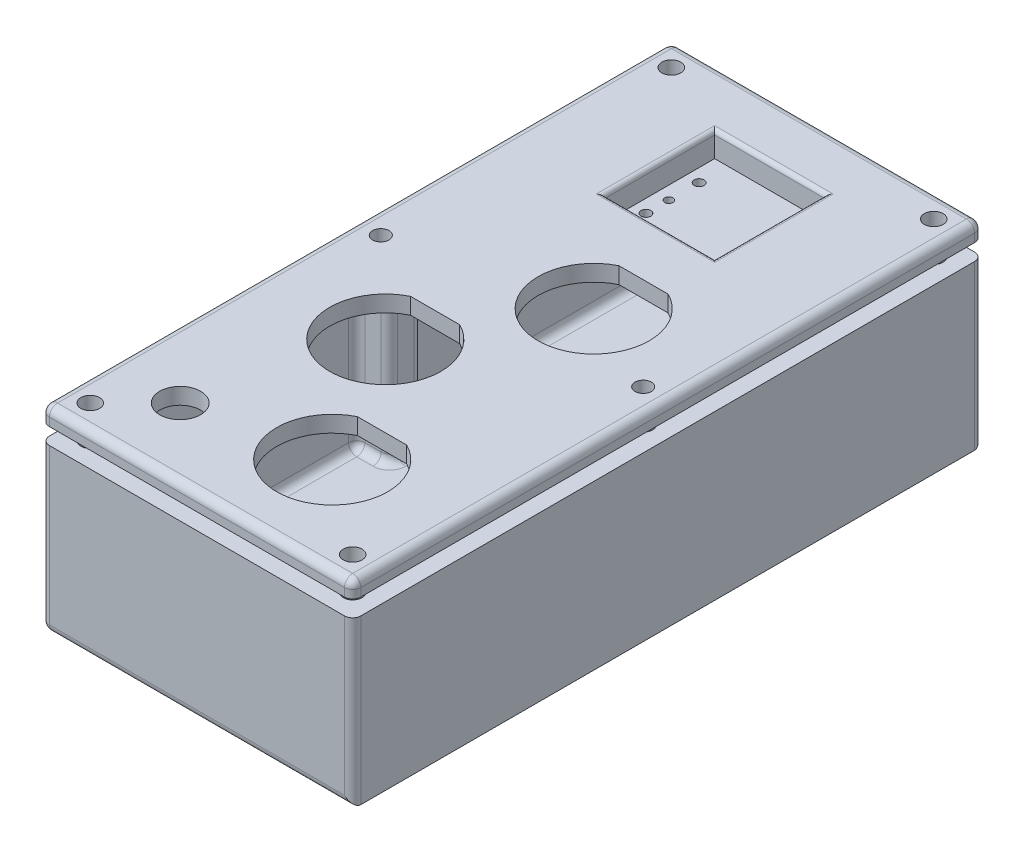
from build123d import *

# Parameters (mm, degrees)
CASE_OUTLINE_SKETCH_W          = 38.1
CASE_OUTLINE_SKETCH_H          = 77.08
BOSS_EXTRUDE1_DEPTH            = 20
CUT_EXTRUDE1_DEPTH             = 18
CASE_FILLET_R                  = 1
LID_SCREW_HOLES_SKETCH_R       = 1.15
CUT_EXTRUDE2_DEPTH             = 16
BOSS_EXTRUDE4_START            = 2
LID_SKETCH_AND_SCREW_HOLES_R   = 1.15
LID_SKETCH_AND_SCREW_HOLES_R_2 = 1
BOSS_EXTRUDE4_DEPTH            = 2
CUT_EXTRUDE3_REACH             = 50.293
LID_CUTTOUTS_SKETCH_R          = 2.5
SPLIT1_START                   = 20
SPLIT1_OUTLINE_R               = 1.15
SPLIT1_OUTLINE_R_2             = 2.5
SPLIT1_OUTLINE_R_3             = 1
SPLIT1_DEPTH                   = 2
SPLIT1_2_OUTLINE_R             = 1.15
SPLIT1_2_OUTLINE_R_2           = 2.5
SPLIT1_2_OUTLINE_R_3           = 1
SPLIT1_2_DEPTH                 = 2
LID_FILLET_R                   = 1
POWER_WIRES_ENTRY_R            = 1.5
CUT_EXTRUDE4_DEPTH             = 2
JOYSTICK_EXTRUSION_W           = 17.5
JOYSTICK_EXTRUSION_H           = 17.5
BOSS_EXTRUDE5_DEPTH            = 4.5
JOYSTICK_INDENTATION_W         = 13.5
JOYSTICK_INDENTATION_H         = 13.5
CUT_EXTRUDE5_DEPTH             = 3
JOYSTICK_HOLES_R               = 0.6
JOYSTICK_HOLES_R_2             = 0.5
CUT_EXTRUDE6_DEPTH             = 1.5
JOYSTICK_SOCKET_FILLET_R       = 0.5


with BuildPart() as part:
    # Case Outline Sketch → Boss-Extrude1 (new body)
    with BuildSketch(Plane(origin=(0, 0, 0), x_dir=(1, 0, 0), z_dir=(0, 1, 0))):
        Rectangle(CASE_OUTLINE_SKETCH_W, CASE_OUTLINE_SKETCH_H)
    extrude(amount=BOSS_EXTRUDE1_DEPTH)

    # Case Interior → Cut-Extrude1 (cut)
    with BuildSketch(Plane(origin=(0, 20, 0), x_dir=(1, 0, 0), z_dir=(0, 1, 0))):
        Polygon((-13.05, 36.54), (13.05, 36.54), (13.05, 32.54), (17.05, 32.54), (17.05, 2.055873023), (13.05, 2.055873023), (13.05, -1.944126977), (17.05, -1.944126977), (17.05, -32.54), (13.05, -32.54), (13.05, -36.54), (-13.05, -36.54), (-13.05, -32.54), (-17.05, -32.54), (-17.05, -1.944126977), (-13.05, -1.944126977), (-13.05, 2.055873023), (-17.05, 2.055873023), (-17.05, 32.54), (-13.05, 32.54), align=None)
    extrude(amount=-CUT_EXTRUDE1_DEPTH, mode=Mode.SUBTRACT)

    # Case Fillet
    case_fillet_edges = [part.edges().sort_by_distance(p)[0] for p in [
        (13.05, 11, -36.54),
        (13.05, 11, -32.54),
        (17.05, 11, -32.54),
        (17.05, 11, -2.055873023),
        (13.05, 11, -2.055873023),
        (13.05, 11, 1.944126977),
        (17.05, 11, 1.944126977),
        (17.05, 11, 32.54),
        (13.05, 11, 32.54),
        (13.05, 11, 36.54),
        (-13.05, 11, 36.54),
        (-13.05, 11, 32.54),
        (-17.05, 11, 32.54),
        (-17.05, 11, 1.944126977),
        (-13.05, 11, 1.944126977),
        (-13.05, 11, -2.055873023),
        (-17.05, 11, -2.055873023),
        (-17.05, 11, -32.54),
        (-13.05, 11, -32.54),
        (-13.05, 11, -36.54),
        (13.05, 2, -34.54),
        (15.05, 2, -32.54),
        (17.05, 2, -17.297936512),
        (15.05, 2, -2.055873023),
        (13.05, 2, -0.055873023),
        (15.05, 2, 1.944126977),
        (17.05, 2, 17.242063488),
        (15.05, 2, 32.54),
        (13.05, 2, 34.54),
        (-13.05, 2, 34.54),
        (-15.05, 2, 32.54),
        (-17.05, 2, 17.242063488),
        (-15.05, 2, 1.944126977),
        (-13.05, 2, -0.055873023),
        (-15.05, 2, -2.055873023),
        (-17.05, 2, -17.297936512),
        (-15.05, 2, -32.54),
        (-13.05, 2, -34.54),
        (0, 2, -36.54),
        (0, 0, 38.54),
        (-19.05, 0, 0),
        (0, 0, -38.54),
        (19.05, 10, 38.54),
        (-19.05, 10, 38.54),
        (-19.05, 10, -38.54),
        (19.05, 10, -38.54),
    ]]
    fillet(case_fillet_edges, radius=CASE_FILLET_R)

    # Lid Screw Holes Sketch → Cut-Extrude2 (cut)
    with BuildSketch(Plane(origin=(0, 20, 0), x_dir=(1, 0, 0), z_dir=(0, 1, 0))):
        with Locations(Location((-16.05, 35.54, 0), (0, 0, 270))):
            Circle(LID_SCREW_HOLES_SKETCH_R)
        with Locations(Location((16.05, 35.54, 0), (0, 0, 270))):
            Circle(LID_SCREW_HOLES_SKETCH_R)
        with Locations(Location((16.05, -35.54, 0), (0, 0, 270))):
            Circle(LID_SCREW_HOLES_SKETCH_R)
        with Locations(Location((-16.05, -35.54, 0), (0, 0, 270))):
            Circle(LID_SCREW_HOLES_SKETCH_R)
        with Locations(Location((-16.05, 0, 0), (0, 0, 270))):
            Circle(LID_SCREW_HOLES_SKETCH_R)
        with Locations(Location((16.05, 0, 0), (0, 0, 270))):
            Circle(LID_SCREW_HOLES_SKETCH_R)
    extrude(amount=-CUT_EXTRUDE2_DEPTH, mode=Mode.SUBTRACT)

    # Lid Sketch (and screw holes) → Boss-Extrude4 (add)
    with BuildSketch(Plane(origin=(0, 20, 0), x_dir=(1, 0, 0), z_dir=(0, 1, 0)).offset(BOSS_EXTRUDE4_START)):
        with BuildLine():
            Line((-19.05, 37.54), (-19.05, -37.54))
            ThreePointArc((-19.05, -37.54), (-18.757106781, -38.247106781), (-18.05, -38.54))
            Line((-18.05, -38.54), (18.05, -38.54))
            ThreePointArc((18.05, -38.54), (18.757106781, -38.247106781), (19.05, -37.54))
            Line((19.05, -37.54), (19.05, 37.54))
            ThreePointArc((19.05, 37.54), (18.757106781, 38.247106781), (18.05, 38.54))
            Line((18.05, 38.54), (-18.05, 38.54))
            ThreePointArc((-18.05, 38.54), (-18.757106781, 38.247106781), (-19.05, 37.54))
        make_face()
        with Locations(Location((-16.05, 35.54, 0), (0, 0, 270))):
            Circle(LID_SKETCH_AND_SCREW_HOLES_R, mode=Mode.SUBTRACT)
        with Locations(Location((-16.05, -35.54, 0), (0, 0, 270))):
            Circle(LID_SKETCH_AND_SCREW_HOLES_R, mode=Mode.SUBTRACT)
        with Locations(Location((16.05, -35.54, 0), (0, 0, 270))):
            Circle(LID_SKETCH_AND_SCREW_HOLES_R, mode=Mode.SUBTRACT)
        with Locations(Location((16.05, 35.54, 0), (0, 0, 270))):
            Circle(LID_SKETCH_AND_SCREW_HOLES_R, mode=Mode.SUBTRACT)
        with Locations(Location((-16.05, 0, 0), (0, 0, 270))):
            Circle(LID_SKETCH_AND_SCREW_HOLES_R_2, mode=Mode.SUBTRACT)
        with Locations(Location((16.05, 0, 0), (0, 0, 270))):
            Circle(LID_SKETCH_AND_SCREW_HOLES_R_2, mode=Mode.SUBTRACT)
    extrude(amount=-BOSS_EXTRUDE4_DEPTH)

    # Lid Cuttouts Sketch → Cut-Extrude3 (cut, up to next)
    with BuildSketch(Plane(origin=(0, 22, 0), x_dir=(1, 0, 0), z_dir=(0, 1, 0)), mode=Mode.PRIVATE) as cut_extrude3_sk1:
        with Locations(Location((-10.55, -30.04, 0), (0, 0, 270))):
            Circle(LID_CUTTOUTS_SKETCH_R)
    cut_extrude3_tool1 = extrude(cut_extrude3_sk1.sketch, amount=-CUT_EXTRUDE3_REACH, mode=Mode.PRIVATE) & part.part
    # Lid Cuttouts Sketch → Cut-Extrude3 (cut, up to next)
    with BuildSketch(Plane(origin=(0, 22, 0), x_dir=(1, 0, 0), z_dir=(0, 1, 0)), mode=Mode.PRIVATE) as cut_extrude3_sk2:
        with BuildLine():
            Line((7.75499584, 11.341869864), (1.74500416, 11.341869864))
            ThreePointArc((1.74500416, 11.341869864), (4.75, -1.558130136), (7.75499584, 11.341869864))
        make_face()
    cut_extrude3_tool2 = extrude(cut_extrude3_sk2.sketch, amount=-CUT_EXTRUDE3_REACH, mode=Mode.PRIVATE) & part.part
    # Lid Cuttouts Sketch → Cut-Extrude3 (cut, up to next)
    with BuildSketch(Plane(origin=(0, 22, 0), x_dir=(1, 0, 0), z_dir=(0, 1, 0)), mode=Mode.PRIVATE) as cut_extrude3_sk3:
        with BuildLine():
            Line((-1.74500416, -4.649065068), (-7.75499584, -4.649065068))
            ThreePointArc((-7.75499584, -4.649065068), (-4.75, -17.549065068), (-1.74500416, -4.649065068))
        make_face()
    cut_extrude3_tool3 = extrude(cut_extrude3_sk3.sketch, amount=-CUT_EXTRUDE3_REACH, mode=Mode.PRIVATE) & part.part
    # Lid Cuttouts Sketch → Cut-Extrude3 (cut, up to next)
    with BuildSketch(Plane(origin=(0, 22, 0), x_dir=(1, 0, 0), z_dir=(0, 1, 0)), mode=Mode.PRIVATE) as cut_extrude3_sk4:
        with BuildLine():
            Line((7.75499584, -20.64), (1.74500416, -20.64))
            ThreePointArc((1.74500416, -20.64), (4.75, -33.54), (7.75499584, -20.64))
        make_face()
    cut_extrude3_tool4 = extrude(cut_extrude3_sk4.sketch, amount=-CUT_EXTRUDE3_REACH, mode=Mode.PRIVATE) & part.part
    add(cut_extrude3_tool1.solids().sort_by_distance((-10.55, 22, 30.04))[0], mode=Mode.SUBTRACT)
    add(cut_extrude3_tool2.solids().sort_by_distance((4.75, 22, -5.114862))[0], mode=Mode.SUBTRACT)
    add(cut_extrude3_tool3.solids().sort_by_distance((-4.75, 22, 10.876073))[0], mode=Mode.SUBTRACT)
    add(cut_extrude3_tool4.solids().sort_by_distance((4.75, 22, 26.867008))[0], mode=Mode.SUBTRACT)

    # Split1 2 outline → Split1 2 (cut)
    with BuildSketch(Plane(origin=(0, 0, 0), x_dir=(1, 0, 0), z_dir=(0, 1, 0)).offset(SPLIT1_START)):
        with BuildLine():
            ThreePointArc((-18.05, 38.54), (-18.757106781, 38.247106781), (-19.05, 37.54))
            Line((-19.05, 37.54), (-19.05, -37.54))
            ThreePointArc((-19.05, -37.54), (-18.757106781, -38.247106781), (-18.05, -38.54))
            Line((-18.05, -38.54), (18.05, -38.54))
            ThreePointArc((18.05, -38.54), (18.757106781, -38.247106781), (19.05, -37.54))
            Line((19.05, -37.54), (19.05, 37.54))
            ThreePointArc((19.05, 37.54), (18.757106781, 38.247106781), (18.05, 38.54))
            Line((18.05, 38.54), (-18.05, 38.54))
        make_face()
        with Locations((-16.05, -35.54)):
            Circle(SPLIT1_2_OUTLINE_R, mode=Mode.SUBTRACT)
        with Locations((-10.55, -30.04)):
            Circle(SPLIT1_2_OUTLINE_R_2, mode=Mode.SUBTRACT)
        with BuildLine():
            ThreePointArc((-1.74500416, -4.649065068), (-4.75, -17.549065068), (-7.75499584, -4.649065068))
            Line((-7.75499584, -4.649065068), (-1.74500416, -4.649065068))
        make_face(mode=Mode.SUBTRACT)
        with BuildLine():
            ThreePointArc((7.75499584, -20.64), (4.75, -33.54), (1.74500416, -20.64))
            Line((1.74500416, -20.64), (7.75499584, -20.64))
        make_face(mode=Mode.SUBTRACT)
        with Locations((16.05, -35.54)):
            Circle(SPLIT1_2_OUTLINE_R, mode=Mode.SUBTRACT)
        with Locations((-16.05, 0)):
            Circle(SPLIT1_2_OUTLINE_R_3, mode=Mode.SUBTRACT)
        with Locations((-16.05, 35.54)):
            Circle(SPLIT1_2_OUTLINE_R, mode=Mode.SUBTRACT)
        with BuildLine():
            ThreePointArc((7.75499584, 11.341869864), (4.75, -1.558130136), (1.74500416, 11.341869864))
            Line((1.74500416, 11.341869864), (7.75499584, 11.341869864))
        make_face(mode=Mode.SUBTRACT)
        with Locations((16.05, 0)):
            Circle(SPLIT1_2_OUTLINE_R_3, mode=Mode.SUBTRACT)
        with Locations((16.05, 35.54)):
            Circle(SPLIT1_2_OUTLINE_R, mode=Mode.SUBTRACT)
    extrude(amount=SPLIT1_2_DEPTH, mode=Mode.SUBTRACT)

    # Power Wires Entry → Cut-Extrude4 (cut)
    with BuildSketch(Plane.XZ):
        with Locations(Location((0, 26.54, 0), (0, 0, 270))):
            Circle(POWER_WIRES_ENTRY_R)
    extrude(amount=-CUT_EXTRUDE4_DEPTH, mode=Mode.SUBTRACT)


with BuildPart() as body_2:
    # Split1: read off the stored shape, not the designer's step
    # Split1 outline → Split1 (new body)
    with BuildSketch(Plane(origin=(0, 0, 0), x_dir=(1, 0, 0), z_dir=(0, 1, 0)).offset(SPLIT1_START)):
        with BuildLine():
            Line((18.05, 38.54), (-18.05, 38.54))
            ThreePointArc((-18.05, 38.54), (-18.757106781, 38.247106781), (-19.05, 37.54))
            Line((-19.05, 37.54), (-19.05, -37.54))
            ThreePointArc((-19.05, -37.54), (-18.757106781, -38.247106781), (-18.05, -38.54))
            Line((-18.05, -38.54), (18.05, -38.54))
            ThreePointArc((18.05, -38.54), (18.757106781, -38.247106781), (19.05, -37.54))
            Line((19.05, -37.54), (19.05, 37.54))
            ThreePointArc((19.05, 37.54), (18.757106781, 38.247106781), (18.05, 38.54))
        make_face()
        with Locations((-16.05, -35.54)):
            Circle(SPLIT1_OUTLINE_R, mode=Mode.SUBTRACT)
        with Locations((-10.55, -30.04)):
            Circle(SPLIT1_OUTLINE_R_2, mode=Mode.SUBTRACT)
        with BuildLine():
            Line((-7.75499584, -4.649065068), (-1.74500416, -4.649065068))
            ThreePointArc((-1.74500416, -4.649065068), (-4.75, -17.549065068), (-7.75499584, -4.649065068))
        make_face(mode=Mode.SUBTRACT)
        with BuildLine():
            Line((1.74500416, -20.64), (7.75499584, -20.64))
            ThreePointArc((7.75499584, -20.64), (4.75, -33.54), (1.74500416, -20.64))
        make_face(mode=Mode.SUBTRACT)
        with Locations((16.05, -35.54)):
            Circle(SPLIT1_OUTLINE_R, mode=Mode.SUBTRACT)
        with Locations((-16.05, 0)):
            Circle(SPLIT1_OUTLINE_R_3, mode=Mode.SUBTRACT)
        with Locations((-16.05, 35.54)):
            Circle(SPLIT1_OUTLINE_R, mode=Mode.SUBTRACT)
        with BuildLine():
            Line((1.74500416, 11.341869864), (7.75499584, 11.341869864))
            ThreePointArc((7.75499584, 11.341869864), (4.75, -1.558130136), (1.74500416, 11.341869864))
        make_face(mode=Mode.SUBTRACT)
        with Locations((16.05, 0)):
            Circle(SPLIT1_OUTLINE_R_3, mode=Mode.SUBTRACT)
        with Locations((16.05, 35.54)):
            Circle(SPLIT1_OUTLINE_R, mode=Mode.SUBTRACT)
    extrude(amount=SPLIT1_DEPTH)

    # Lid Fillet
    lid_fillet_edges = [body_2.edges().sort_by_distance(p)[0] for p in [
        (-18.757106781, 22, -38.247106781),
        (-19.05, 22, 0),
        (-18.757106781, 22, 38.247106781),
        (0, 22, 38.54),
        (18.757106781, 22, 38.247106781),
        (19.05, 22, 0),
        (18.757106781, 22, -38.247106781),
        (0, 22, -38.54),
    ]]
    fillet(lid_fillet_edges, radius=LID_FILLET_R)


with BuildPart() as body_2_1:
    # Body-Move/Copy2: read off the stored shape, not the designer's step
    # Body-Move/Copy2: moved
    add(body_2.part.moved(Location((0, 2, 0))))

    # Joystick Extrusion → Boss-Extrude5 (add)
    with BuildSketch(Plane(origin=(0, 24, 0), x_dir=(1, 0, 0), z_dir=(0, 1, 0))):
        with Locations((0, 24.79)):
            Rectangle(JOYSTICK_EXTRUSION_W, JOYSTICK_EXTRUSION_H)
    extrude(amount=-BOSS_EXTRUDE5_DEPTH)

    # Joystick Indentation → Cut-Extrude5 (cut)
    with BuildSketch(Plane(origin=(0, 24, 0), x_dir=(1, 0, 0), z_dir=(0, 1, 0))):
        with Locations((0, 24.79)):
            Rectangle(JOYSTICK_INDENTATION_W, JOYSTICK_INDENTATION_H)
    extrude(amount=-CUT_EXTRUDE5_DEPTH, mode=Mode.SUBTRACT)

    # Joystick Holes → Cut-Extrude6 (cut)
    with BuildSketch(Plane(origin=(0, 21, 0), x_dir=(1, 0, 0), z_dir=(0, 1, 0))):
        with Locations(Location((-5.15, 28.04, 0), (0, 0, 270))):
            Circle(JOYSTICK_HOLES_R)
        with Locations(Location((-5.15, 24.34, 0), (0, 0, 270))):
            Circle(JOYSTICK_HOLES_R_2)
        with Locations(Location((-5.15, 21.54, 0), (0, 0, 270))):
            Circle(JOYSTICK_HOLES_R)
        with Locations(Location((5.15, 21.54, 0), (0, 0, 270))):
            Circle(JOYSTICK_HOLES_R)
        with Locations(Location((5.15, 24.34, 0), (0, 0, 270))):
            Circle(JOYSTICK_HOLES_R_2)
        with Locations(Location((5.15, 28.04, 0), (0, 0, 270))):
            Circle(JOYSTICK_HOLES_R)
    extrude(amount=-CUT_EXTRUDE6_DEPTH, mode=Mode.SUBTRACT)

    # Joystick Socket Fillet
    joystick_socket_fillet_edges = [body_2_1.edges().sort_by_distance(p)[0] for p in [
        (8.75, 22, -24.79),
        (0, 22, -16.04),
        (-8.75, 22, -24.79),
        (0, 22, -33.54),
        (6.75, 24, -24.79),
        (0, 24, -31.54),
        (-6.75, 24, -24.79),
        (0, 24, -18.04),
    ]]
    fillet(joystick_socket_fillet_edges, radius=JOYSTICK_SOCKET_FILLET_R)


solid = Compound([part.part, body_2_1.part])
